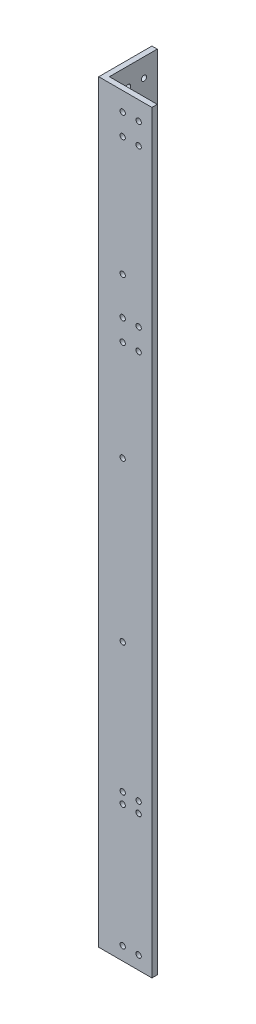
from build123d import *

# Parameters (mm, degrees)
BOSS_EXTRUDE1_DEPTH              = 450
LEFTSIDEHOLES_SKETCH3_R          = 1.5875
LEFTSIDEHOLES_CUT_EXTRUDE1_DEPTH = 3.175
BACKSIDEHOLES_SKETCH4_R          = 1.5875
BACKSIDEHOLES_CUT_EXTRUDE2_DEPTH = 3.175


with BuildPart() as part:
    # Sketch2 → Boss-Extrude1 (new body)
    with BuildSketch(Plane(origin=(0, 0, 0), x_dir=(1, 0, 0), z_dir=(0, 1, 0))):
        Polygon((0, 31.75), (3.175, 31.75), (3.175, 3.175), (31.75, 3.175), (31.75, 0), (0, 0), align=None)
    extrude(amount=BOSS_EXTRUDE1_DEPTH)

    # LeftSideHoles-Sketch3 → LeftSideHoles-Cut-Extrude1 (cut)
    with BuildSketch(Plane.XY):
        with Locations((14.2875, 81.1125)):
            Circle(LEFTSIDEHOLES_SKETCH3_R)
        with Locations((23.8125, 81.1125)):
            Circle(LEFTSIDEHOLES_SKETCH3_R)
        with Locations((14.2875, 87.4625)):
            Circle(LEFTSIDEHOLES_SKETCH3_R)
        with Locations((23.8125, 87.4625)):
            Circle(LEFTSIDEHOLES_SKETCH3_R)
        with Locations((14.2875, 438.8875)):
            Circle(LEFTSIDEHOLES_SKETCH3_R)
        with Locations((14.2875, 426.1875)):
            Circle(LEFTSIDEHOLES_SKETCH3_R)
        with Locations((23.8125, 438.8875)):
            Circle(LEFTSIDEHOLES_SKETCH3_R)
        with Locations((23.8125, 426.1875)):
            Circle(LEFTSIDEHOLES_SKETCH3_R)
        with Locations((14.2875, 332.602644)):
            Circle(LEFTSIDEHOLES_SKETCH3_R)
        with Locations((23.8125, 332.602644)):
            Circle(LEFTSIDEHOLES_SKETCH3_R)
        with Locations((14.2875, 319.902644)):
            Circle(LEFTSIDEHOLES_SKETCH3_R)
        with Locations((23.8125, 319.902644)):
            Circle(LEFTSIDEHOLES_SKETCH3_R)
        with Locations((14.2875, 7.9375)):
            Circle(LEFTSIDEHOLES_SKETCH3_R)
        with Locations((23.8125, 7.9375)):
            Circle(LEFTSIDEHOLES_SKETCH3_R)
        with Locations((14.2875, 165)):
            Circle(LEFTSIDEHOLES_SKETCH3_R)
        with Locations((14.2875, 260)):
            Circle(LEFTSIDEHOLES_SKETCH3_R)
        with Locations((14.2875, 355)):
            Circle(LEFTSIDEHOLES_SKETCH3_R)
    extrude(amount=-LEFTSIDEHOLES_CUT_EXTRUDE1_DEPTH, mode=Mode.SUBTRACT)

    # BackSideHoles-Sketch4 → BackSideHoles-Cut-Extrude2 (cut)
    with BuildSketch(Plane.ZY):
        with Locations((-23.8125, 81.1125)):
            Circle(BACKSIDEHOLES_SKETCH4_R)
        with Locations((-14.2875, 81.1125)):
            Circle(BACKSIDEHOLES_SKETCH4_R)
        with Locations((-23.8125, 87.4625)):
            Circle(BACKSIDEHOLES_SKETCH4_R)
        with Locations((-14.2875, 87.4625)):
            Circle(BACKSIDEHOLES_SKETCH4_R)
        with Locations((-23.8125, 438.8875)):
            Circle(BACKSIDEHOLES_SKETCH4_R)
        with Locations((-14.2875, 438.8875)):
            Circle(BACKSIDEHOLES_SKETCH4_R)
        with Locations((-23.8125, 426.1875)):
            Circle(BACKSIDEHOLES_SKETCH4_R)
        with Locations((-14.2875, 426.1875)):
            Circle(BACKSIDEHOLES_SKETCH4_R)
        with Locations((-23.8125, 332.602644)):
            Circle(BACKSIDEHOLES_SKETCH4_R)
        with Locations((-14.2875, 332.602644)):
            Circle(BACKSIDEHOLES_SKETCH4_R)
        with Locations((-23.8125, 326.252644)):
            Circle(BACKSIDEHOLES_SKETCH4_R)
        with Locations((-14.2875, 326.252644)):
            Circle(BACKSIDEHOLES_SKETCH4_R)
        with Locations((-14.2875, 165)):
            Circle(BACKSIDEHOLES_SKETCH4_R)
        with Locations((-14.2875, 260)):
            Circle(BACKSIDEHOLES_SKETCH4_R)
        with Locations((-14.2875, 355)):
            Circle(BACKSIDEHOLES_SKETCH4_R)
        with Locations((-23.8125, 7.9375)):
            Circle(BACKSIDEHOLES_SKETCH4_R)
        with Locations((-14.2875, 7.9375)):
            Circle(BACKSIDEHOLES_SKETCH4_R)
    extrude(amount=-BACKSIDEHOLES_CUT_EXTRUDE2_DEPTH, mode=Mode.SUBTRACT)


solid = part.part
